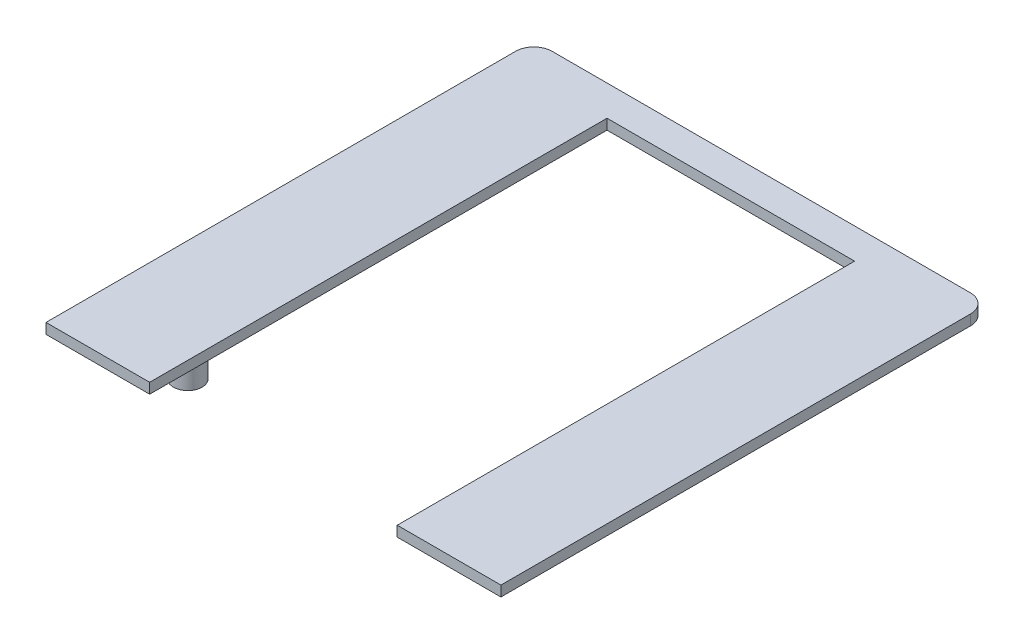
from build123d import *

# Parameters (mm, degrees)
BOSS_EXTRUDE1_DEPTH = 1.7
SKETCH2_R           = 2.35
BOSS_EXTRUDE2_DEPTH = 4.7
FILLET1_R           = 3
SKETCH3_R           = 2.4
CUT_EXTRUDE1_DEPTH  = 1


with BuildPart() as part:
    # Sketch1 → Boss-Extrude1 (new body)
    with BuildSketch(Plane(origin=(0, 0, 0), x_dir=(1, 0, 0), z_dir=(0, 1, 0))):
        Polygon((0, 0), (0, 80), (37.3, 80), (37.3, 75), (17, 75), (17, 0), align=None)
    extrude(amount=BOSS_EXTRUDE1_DEPTH)

    # Sketch2 → Boss-Extrude2 (add)
    with BuildSketch(Plane(origin=(0, 0, 0), x_dir=(-1, 0, 0), z_dir=(0, -1, 0))):
        with Locations((-13.25, 10)):
            Circle(SKETCH2_R)
        with Locations((-8, 72)):
            Circle(SKETCH2_R)
    extrude(amount=BOSS_EXTRUDE2_DEPTH)

    # Fillet1
    fillet1_edges = [part.edges().sort_by_distance(p)[0] for p in [
        (0, 0.85, -80),
    ]]
    fillet(fillet1_edges, radius=FILLET1_R)

    # Sketch3 → Cut-Extrude1 (cut)
    with BuildSketch(Plane(origin=(0, 0, 0), x_dir=(-1, 0, 0), z_dir=(0, -1, 0))):
        with Locations((-13.25, 61.25)):
            Circle(SKETCH3_R)
    extrude(amount=-CUT_EXTRUDE1_DEPTH, mode=Mode.SUBTRACT)

    # Mirror3: part across plane


with BuildPart() as part_1:
    add(part.part)
    add(part.part.mirror(Plane(origin=(37.3, 1.7, -80), x_dir=(0, 0, 1), z_dir=(-1, 0, 0))))


solid = part_1.part
